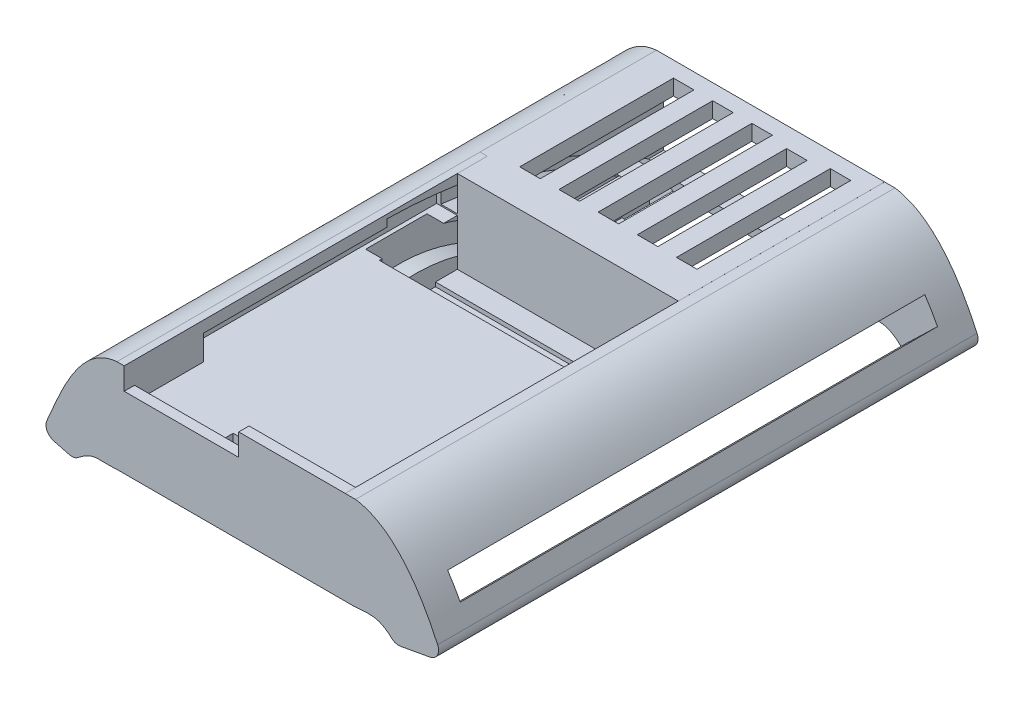
from build123d import *

# Parameters (mm, degrees)
BOSS_EXTRUDE2_DEPTH      = 52
FILLET2_R                = 1
CUT_EXTRUDE2_DEPTH       = 3
CUT_EXTRUDE2_DEPTH_BACK  = 6
SKETCH10_W               = 2.350757351
SKETCH10_H               = 46
SKETCH11_W               = 17
SKETCH11_H               = 15
PELTIER_DEPTH            = 10
SKETCH12_W               = 21
SKETCH12_H               = 29
BATTERY_DEPTH            = 0.4
SKETCH14_W               = 21.3
SKETCH14_H               = 1
BOSS_EXTRUDE4_DEPTH      = 7.999920354
SKETCH15_W               = 3.297714658
SKETCH15_H               = 0.629450307
CUT_EXTRUDE5_DEPTH       = 3.6
SKETCH16_W               = 2.795507754
SKETCH16_H               = 0.669410668
CUT_EXTRUDE6_DEPTH       = 4.337027413
FILLET3_R                = 1
CUT_EXTRUDE7_DEPTH       = 1.6
CUT_EXTRUDE8_DEPTH       = 1.6
FILLET4_R                = 1
FILLET5_R                = 1
SKETCH19_W               = 21.3
SKETCH19_H               = 1
BOSS_EXTRUDE5_DEPTH      = 23.6
SKETCH20_W               = 7.625924169
SKETCH20_H               = 2.120993271
CUT_EXTRUDE9_DEPTH       = 2.6
SKETCH21_W               = 21.3
SKETCH21_H               = 2.886084762
BOSS_EXTRUDE6_DEPTH      = 8
SKETCH22_W               = 17
SKETCH22_H               = 1.5
BOSS_EXTRUDE7_DEPTH      = 22
SKETCH23_W               = 24.481547991
SKETCH23_H               = 2.403526745
CUT_EXTRUDE10_DEPTH      = 2
SKETCH24_W               = 15
SKETCH24_H               = 0.211445756
BOSS_EXTRUDE8_DEPTH      = 2
SKETCH25_W               = 4.787241237
SKETCH25_H               = 0.237383131
BOSS_EXTRUDE9_DEPTH      = 2
SKETCH26_W               = 11.036128308
SKETCH26_H               = 2.126226966
CUT_EXTRUDE11_DEPTH      = 2
CUT_EXTRUDE12_DEPTH      = 2
CUT_EXTRUDE12_DEPTH_BACK = 11
SKETCH27_W               = 46
SKETCH27_H               = 2.33
SKETCH28_W               = 1.978966
SKETCH28_H               = 14.822133623
SKETCH28_H_2             = 14.389327905
SKETCH28_W_2             = 1.978965999
CUT_EXTRUDE13_DEPTH      = 3


with BuildPart() as part:
    # Sketch1 → Boss-Extrude2 (new body)
    with BuildSketch(Plane.XY):
        with BuildLine():
            Line((-4.066957942, -1.190846618), (-7.240355005, -0.354620493))
            add(Edge.make_bspline(
                [(0.042333709, 8.998333002), (-4.213116867, 8.648828695), (-5.962383558, 1.81462105), (-7.240355005, -0.354620493)],
                knots=[0, 0, 0, 0, 1, 1, 1, 1], degree=3))
            Line((0.042333709, 8.998333002), (0.742333709, 8.998333002))
            Line((0.742333709, 8.998333002), (0.742333709, 1))
            Line((0.742333709, 1), (22.042333709, 1))
            Line((22.042333709, 1), (22.042333709, 8.998333002))
            Line((22.042333709, 8.998333002), (23.042333709, 8.998333002))
            add(Edge.make_bspline(
                [(23.042333709, 8.998333002), (27.852391375, 8.27132168), (31.467788923, -0.354620493)],
                knots=[0, 0, 0, 1, 1, 1], degree=2))
            Line((31.467788923, -0.354620493), (26.875523276, -1.190846618))
            add(Edge.make_bspline(
                [(22.86911945, 0), (24.564241842, 0.074416087), (25.297281614, 0.429058332), (26.875523276, -1.190846618)],
                knots=[0, 0, 0, 0, 1, 1, 1, 1], degree=3))
            Line((22.86911945, 0), (0, 0))
            add(Edge.make_bspline(
                [(0, 0), (-1.870814346, -0.163675047), (-2.239916233, 0.430706612), (-4.066957942, -1.190846618)],
                knots=[0, 0, 0, 0, 1, 1, 1, 1], degree=3))
        make_face()
    extrude(amount=BOSS_EXTRUDE2_DEPTH)

    # Fillet2
    fillet2_edges = [part.edges().sort_by_distance(p)[0] for p in [
        (-4.066957942, -1.190846618, 26),
        (-7.240355005, -0.354620493, 26),
    ]]
    fillet(fillet2_edges, radius=FILLET2_R)

    # Sketch10 → Cut-Extrude2 (cut, two sides: drawn at the far end of the back side and taken through both)
    with BuildSketch(Plane(origin=(-4.380890916, 3.569201652, 0), x_dir=(0.6316290075695021, 0.7752707893354205, 0), z_dir=(-0.7752707893354205, 0.6316290075695021, 0)).offset(-CUT_EXTRUDE2_DEPTH_BACK)):
        with Locations((-1.831509184, -27)):
            Rectangle(SKETCH10_W, SKETCH10_H)
    extrude(amount=CUT_EXTRUDE2_DEPTH + CUT_EXTRUDE2_DEPTH_BACK, mode=Mode.SUBTRACT)

    # Sketch11 → Peltier (cut)
    with BuildSketch(Plane(origin=(0, 1, 0), x_dir=(1, 0, 0), z_dir=(0, 1, 0))):
        with Locations((12.114692368, -9.5)):
            Rectangle(SKETCH11_W, SKETCH11_H)
    extrude(amount=-PELTIER_DEPTH, mode=Mode.SUBTRACT)

    # Sketch12 → Battery (cut)
    with BuildSketch(Plane(origin=(0, 1, 0), x_dir=(1, 0, 0), z_dir=(0, 1, 0))):
        with Locations((11.242333709, -36.5)):
            Rectangle(SKETCH12_W, SKETCH12_H)
    extrude(amount=-BATTERY_DEPTH, mode=Mode.SUBTRACT)

    # Sketch14 → Boss-Extrude4 (add)
    with BuildSketch(Plane(origin=(0, 1, 0), x_dir=(1, 0, 0), z_dir=(0, 1, 0))):
        with Locations((11.392333709, -51.5)):
            Rectangle(SKETCH14_W, SKETCH14_H)
    extrude(amount=BOSS_EXTRUDE4_DEPTH)

    # Sketch15 → Cut-Extrude5 (cut)
    with BuildSketch(Plane(origin=(3.614692368, 0, 0), x_dir=(0, 0, -1), z_dir=(1, 0, 0))):
        with Locations((-15.351142671, 0.685274847)):
            Rectangle(SKETCH15_W, SKETCH15_H)
    extrude(amount=-CUT_EXTRUDE5_DEPTH, mode=Mode.SUBTRACT)

    # Sketch16 → Cut-Extrude6 (cut)
    with BuildSketch(Plane(origin=(3.614692368, 0, 0), x_dir=(0, 0, -1), z_dir=(1, 0, 0))):
        with Locations((-2.862635658, 0.665294666)):
            Rectangle(SKETCH16_W, SKETCH16_H)
    extrude(amount=-CUT_EXTRUDE6_DEPTH, mode=Mode.SUBTRACT)

    # Fillet3
    # the kernel refuses this fillet: 1 mm, written as the material it takes off along each edge
    with BuildSketch(Plane(origin=(3.614692368, 0.330589332, 2), x_dir=(0, -1, 0), z_dir=(0, 0, 1))) as fillet3_piece_1:
        with BuildLine():
            CenterArc((1, -0.742892561), FILLET3_R, 132.021596152, 47.978403848)
            Line((0, -0.742892561), (0, 0))
            Line((0, 0), (0.330589332, 0))
        make_face()
    extrude(amount=2.260389535, mode=Mode.SUBTRACT)
    with BuildSketch(Plane(origin=(3.614692368, 0.370549693, 17), x_dir=(0, -1, 0), z_dir=(0, 0, -1))) as fillet3_piece_2:
        with BuildLine():
            CenterArc((1, 0.77704074), FILLET3_R, 180, 50.990421184)
            Line((0, 0.77704074), (0, 0))
            Line((0, 0), (0.370549693, 0))
        make_face()
    extrude(amount=3.297714658, mode=Mode.SUBTRACT)

    # Sketch17 → Cut-Extrude7 (cut)
    with BuildSketch(Plane(origin=(0.742333709, 0, 0), x_dir=(0, 0, -1), z_dir=(1, 0, 0))):
        with BuildLine():
            Line((-26.679947222, 8.607264172), (-26.679947222, 5.897267678))
            add(Edge.make_bspline(
                [(-4.260389535, 1), (-14.867625221, 6.272509714), (-26.679947222, 5.897267678)],
                knots=[0, 0, 0, 1, 1, 1], degree=2))
            Line((-4.260389535, 1), (-1.464881781, 1))
            add(Edge.make_bspline(
                [(-1.464881781, 1), (-12.835212302, 8.374655541), (-26.679947222, 8.607264172)],
                knots=[0, 0, 0, 1, 1, 1], degree=2))
        make_face()
    extrude(amount=-CUT_EXTRUDE7_DEPTH, mode=Mode.SUBTRACT)

    # Sketch18 → Cut-Extrude8 (cut)
    with BuildSketch(Plane(origin=(0.742333709, 0, 0), x_dir=(0, 0, -1), z_dir=(1, 0, 0))):
        with BuildLine():
            Line((-27.127269804, 2.333242891), (-27.127269804, 5.881050361))
            add(Edge.make_bspline(
                [(-13.702285342, 1), (-19.59820355, 6.798459793), (-27.127269804, 5.881050361)],
                knots=[0, 0, 0, 1, 1, 1], degree=2))
            Line((-13.702285342, 1), (-17, 1))
            add(Edge.make_bspline(
                [(-17, 1), (-21.902562333, 3.381704282), (-27.127269804, 2.333242891)],
                knots=[0, 0, 0, 1, 1, 1], degree=2))
        make_face()
    extrude(amount=-CUT_EXTRUDE8_DEPTH, mode=Mode.SUBTRACT)

    # Fillet4
    fillet4_edges = [part.edges().sort_by_distance(p)[0] for p in [
        (26.875523276, -1.190846618, 26),
    ]]
    fillet(fillet4_edges, radius=FILLET4_R)

    # Fillet5
    fillet5_edges = [part.edges().sort_by_distance(p)[0] for p in [
        (31.467788923, -0.354620493, 26),
    ]]
    fillet(fillet5_edges, radius=FILLET5_R)

    # Sketch19 → Boss-Extrude5 (add)
    with BuildSketch(Plane(origin=(0, 0, 51), x_dir=(-1, 0, 0), z_dir=(0, 0, -1))):
        with Locations((-11.392333709, 5)):
            Rectangle(SKETCH19_W, SKETCH19_H)
    extrude(amount=BOSS_EXTRUDE5_DEPTH)

    # Sketch20 → Cut-Extrude9 (cut)
    with BuildSketch(Plane(origin=(0, 5.5, 0), x_dir=(1, 0, 0), z_dir=(0, 1, 0))):
        with Locations((11.936871332, -49.939503364)):
            Rectangle(SKETCH20_W, SKETCH20_H)
    extrude(amount=-CUT_EXTRUDE9_DEPTH, mode=Mode.SUBTRACT)

    # Sketch21 → Boss-Extrude6 (add)
    with BuildSketch(Plane(origin=(0, 1, 0), x_dir=(1, 0, 0), z_dir=(0, 1, 0))):
        with Locations((11.392333709, -18.443042381)):
            Rectangle(SKETCH21_W, SKETCH21_H)
    extrude(amount=BOSS_EXTRUDE6_DEPTH)

    # Sketch22 → Boss-Extrude7 (add)
    with BuildSketch(Plane.ZY.offset(-22.042333709)):
        with Locations((8.5, 8.25)):
            Rectangle(SKETCH22_W, SKETCH22_H)
    extrude(amount=BOSS_EXTRUDE7_DEPTH)

    # Sketch23 → Cut-Extrude10 (cut)
    with BuildSketch(Plane(origin=(0.742333709, 0, 0), x_dir=(0, 0, -1), z_dir=(1, 0, 0))):
        with Locations((-32.126858758, 6.701763373)):
            Rectangle(SKETCH23_W, SKETCH23_H)
    extrude(amount=-CUT_EXTRUDE10_DEPTH, mode=Mode.SUBTRACT)

    # Sketch24 → Boss-Extrude8 (add)
    with BuildSketch(Plane.ZY.offset(-20.614692368)):
        with Locations((9.5, 0.105722878)):
            Rectangle(SKETCH24_W, SKETCH24_H)
    extrude(amount=BOSS_EXTRUDE8_DEPTH)

    # Sketch25 → Boss-Extrude9 (add)
    with BuildSketch(Plane(origin=(3.614692368, 0, 0), x_dir=(0, 0, -1), z_dir=(1, 0, 0))):
        with Locations((-9.281203123, 0.118691566)):
            Rectangle(SKETCH25_W, SKETCH25_H)
    extrude(amount=BOSS_EXTRUDE9_DEPTH)

    # Sketch26 → Cut-Extrude11 (cut)
    with BuildSketch(Plane(origin=(0, 0, 51), x_dir=(-1, 0, 0), z_dir=(0, 0, -1))):
        with Locations((-6.260397863, 7.936806871)):
            Rectangle(SKETCH26_W, SKETCH26_H)
    extrude(amount=-CUT_EXTRUDE11_DEPTH, mode=Mode.SUBTRACT)

    # Sketch27 → Cut-Extrude12 (cut, two sides: drawn at the far end of the back side and taken through both)
    with BuildSketch(Plane(origin=(16.401330443, 15.864191281, 0), x_dir=(0, 0, -1), z_dir=(0.7187787233935903, 0.6952389134654942, 0)).offset(-CUT_EXTRUDE12_DEPTH_BACK)):
        with Locations((-26, -18.013212029)):
            Rectangle(SKETCH27_W, SKETCH27_H)
    extrude(amount=CUT_EXTRUDE12_DEPTH + CUT_EXTRUDE12_DEPTH_BACK, mode=Mode.SUBTRACT)

    # Sketch28 → Cut-Extrude13 (cut)
    with BuildSketch(Plane(origin=(0, 9, 0), x_dir=(1, 0, 0), z_dir=(0, 1, 0))):
        with Locations((19.299375066, -8.918059871)):
            Rectangle(SKETCH28_W, SKETCH28_H)
        with Locations((15.520409066, -9.13446273)):
            Rectangle(SKETCH28_W, SKETCH28_H_2)
        with Locations((11.741443067, -8.918059871)):
            Rectangle(SKETCH28_W_2, SKETCH28_H)
        with Locations((7.962477067, -8.918059871)):
            Rectangle(SKETCH28_W, SKETCH28_H)
        with Locations((4.183511067, -8.918059871)):
            Rectangle(SKETCH28_W, SKETCH28_H)
    extrude(amount=-CUT_EXTRUDE13_DEPTH, mode=Mode.SUBTRACT)


solid = part.part
